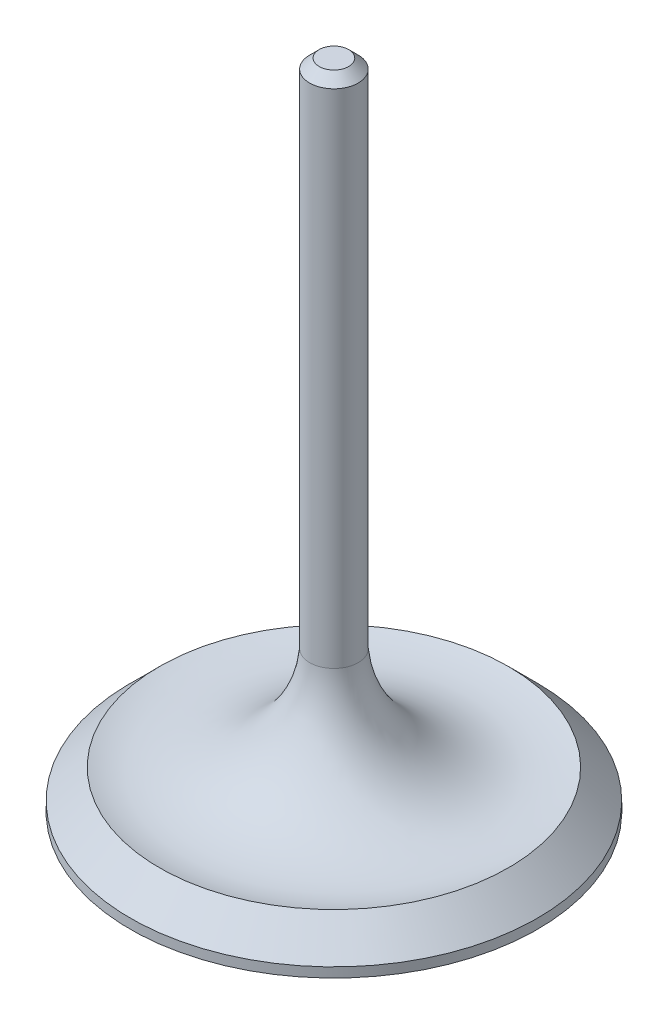
from build123d import *

# Parameters (mm, degrees)
CHAMFER1_SIZE = 1.25
SCALE1_SCALE  = 0.51948


with BuildPart() as part:
    # Sketch1 → Revolve1 (revolve)
    with BuildSketch(Plane(origin=(0, 0, 0), x_dir=(0, 0, -1), z_dir=(1, 0, 0))):
        with BuildLine():
            Line((0, 0), (0, 85.55))
            Line((0, 85.55), (3.18, 85.55))
            Line((3.18, 85.55), (3.18, 18.522021385))
            ThreePointArc((3.18, 18.522021385), (9.786228155, 7.066556842), (22.86, 5.08))
            Line((22.86, 5.08), (26.67, 1.27))
            Line((26.67, 1.27), (26.67, 0))
            Line((26.67, 0), (0, 0))
        make_face()
    revolve(axis=Axis((0, 0, 0), (0, 1, 0)))

    # Chamfer1
    chamfer1_edges = [part.edges().sort_by_distance(p)[0] for p in [
        (0, 85.55, 3.18),
    ]]
    chamfer(chamfer1_edges, length=CHAMFER1_SIZE)


with BuildPart() as part_1:
    # Scale1: scaled about (0, 10.77364821, 0)
    add(part.part.scale(SCALE1_SCALE).moved(Location((0, 5.176953438, 0))))


solid = part_1.part
